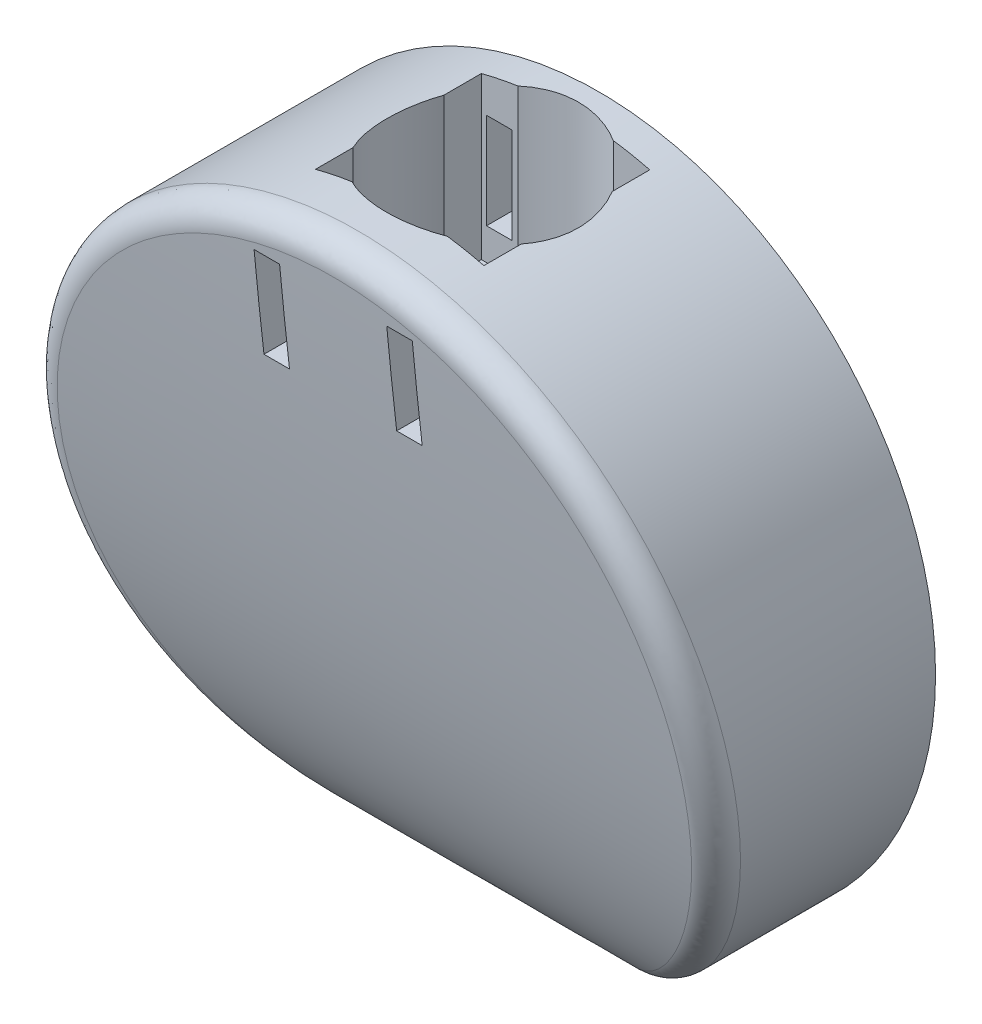
from build123d import *

# Parameters (mm, degrees)
ESQUISSE1_R                  = 67.000000112
BOSS_EXTRU_1_DEPTH           = 53.34
ENL_V_MAT_EXTRU_1_DEPTH      = 110.092762836
ENL_V_MAT_EXTRU_1_DEPTH_BACK = 110.092762836
CONG_1_R                     = 5
ENL_V_MAT_EXTRU_4_DEPTH      = 34.29
ESQUISSE10_W                 = 5.08
ESQUISSE10_H                 = 19.05
ENL_V_MAT_EXTRU_7_DEPTH      = 106.962329583
SYM_TRIE2_COPY_1_SKETCH_W    = 5.08
SYM_TRIE2_COPY_1_SKETCH_H    = 19.05
SYM_TRIE2_COPY_1_DEPTH       = 106.962329583
ESQUISSE7_R                  = 7.62
ENL_V_MAT_EXTRU_8_DEPTH      = 6.35


with BuildPart() as part:
    # Esquisse1 → Boss.-Extru.1 (new body)
    with BuildSketch(Plane.XY):
        with Locations((0.290695021, 0.290695021)):
            Circle(ESQUISSE1_R)
    extrude(amount=BOSS_EXTRU_1_DEPTH)

    # Esquisse4 → Enlèv. mat.-Extru.1 (cut, two sides: drawn at the far end of the back side and taken through both)
    with BuildSketch(Plane(origin=(0, 0, 0), x_dir=(0, 0, -1), z_dir=(1, 0, 0)).offset(-ENL_V_MAT_EXTRU_1_DEPTH_BACK)):
        with BuildLine():
            Line((-0.142164152, -67.127156989), (-53.34, -66.709305091))
            Line((-53.34, -66.709305091), (-53.34, 67.290695133))
            add(Edge.make_bspline(
                [(-53.34, 67.290695133), (-53.314901524, 64.965334409), (-44.651911328, -34.890273822), (-23.160447153, -66.373438876), (-0.142164152, -67.127156989)],
                knots=[0, 0, 0, 0, 0.3629696, 1, 1, 1, 1], degree=3))
        make_face()
    extrude(amount=ENL_V_MAT_EXTRU_1_DEPTH + ENL_V_MAT_EXTRU_1_DEPTH_BACK, mode=Mode.SUBTRACT)

    # Congé1
    cong_1_edges = [part.edges().sort_by_distance(p)[0] for p in [
        (-66.598538996, -3.560329145, 44.401259726),
    ]]
    fillet(cong_1_edges, radius=CONG_1_R)

    # Esquisse6 → Enlèv. mat.-Extru.4 (cut)
    with BuildSketch(Plane(origin=(0, 67.290695133, 0), x_dir=(1, 0, 0), z_dir=(0, 1, 0))):
        with BuildLine():
            Line((-16.783304867, -6.35), (-9.523114629, -6.35))
            ThreePointArc((-9.523114629, -6.35), (-0.019304867, -3.81), (9.484504896, -6.35))
            Line((9.484504896, -6.35), (16.744695133, -6.35))
            Line((16.744695133, -6.35), (16.744695133, -13.81175133))
            ThreePointArc((16.744695133, -13.81175133), (19.030695133, -22.86), (16.744695133, -31.90824867))
            Line((16.744695133, -31.90824867), (16.744695133, -39.37))
            Line((16.744695133, -39.37), (9.484504896, -39.37))
            ThreePointArc((9.484504896, -39.37), (-0.019304867, -41.91), (-9.523114629, -39.37))
            Line((-9.523114629, -39.37), (-16.783304867, -39.37))
            Line((-16.783304867, -39.37), (-16.783304867, -31.90824867))
            ThreePointArc((-16.783304867, -31.90824867), (-19.069304867, -22.86), (-16.783304867, -13.81175133))
            Line((-16.783304867, -13.81175133), (-16.783304867, -6.35))
        make_face()
    extrude(amount=-ENL_V_MAT_EXTRU_4_DEPTH, mode=Mode.SUBTRACT)

    # Esquisse10 → Enlèv. mat.-Extru.7 (cut, through all)
    with BuildSketch(Plane.XY.offset(6.35)):
        with Locations((-13.206114629, 48.875695133)):
            Rectangle(ESQUISSE10_W, ESQUISSE10_H)
    enl_v_mat_extru_7 = extrude(amount=-ENL_V_MAT_EXTRU_7_DEPTH, mode=Mode.SUBTRACT)

    # Symétrie1: Enlèv. mat.-Extru.7 across plane
    add(enl_v_mat_extru_7.mirror(Plane(origin=(0, 0, 0), x_dir=(0, 0, 1), z_dir=(1, 0, 0))), mode=Mode.SUBTRACT)

    # Symétrie2: Enlèv. mat.-Extru.7 across plane
    add(enl_v_mat_extru_7.mirror(Plane(origin=(0, 0, 22.859072449), x_dir=(1, 0, 0), z_dir=(0, 0, -1))), mode=Mode.SUBTRACT)

    # Symétrie2 copy 1 sketch → Symétrie2 copy 1 (cut, through all)
    with BuildSketch(Plane(origin=(0, 0, 39.368144898), x_dir=(-1, 0, 0), z_dir=(0, 0, -1))):
        with Locations((-13.206114629, 48.875695133)):
            Rectangle(SYM_TRIE2_COPY_1_SKETCH_W, SYM_TRIE2_COPY_1_SKETCH_H)
    extrude(amount=-SYM_TRIE2_COPY_1_DEPTH, mode=Mode.SUBTRACT)

    # Esquisse7 → Enlèv. mat.-Extru.8 (cut)
    with BuildSketch(Plane(origin=(0, 35.540695133, 0), x_dir=(1, 0, 0), z_dir=(0, 1, 0))):
        with Locations((-0.019304867, -22.86)):
            Circle(ESQUISSE7_R)
    extrude(amount=-ENL_V_MAT_EXTRU_8_DEPTH, mode=Mode.SUBTRACT)


solid = part.part
